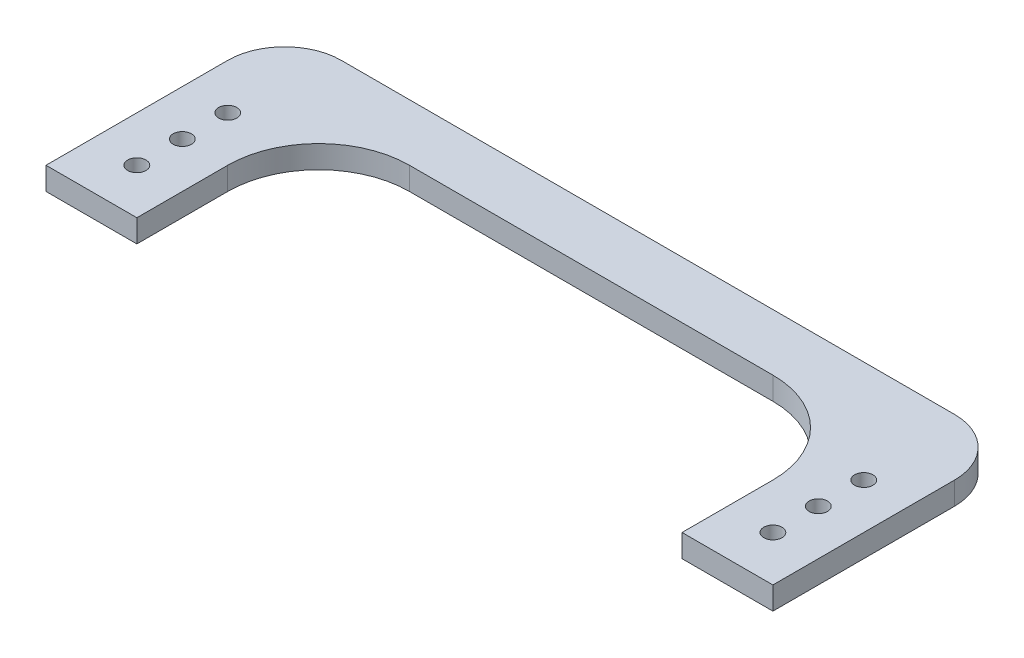
from build123d import *

# Parameters (mm, degrees)
BOSS_EXTRUDE1_DEPTH    = 6.35
F_10_CLEARANCE_HOLE1_D = 5.1054


with BuildPart() as part:
    # Sketch1 → Boss-Extrude1 (new body)
    with BuildSketch(Plane(origin=(0, 0, 0), x_dir=(1, 0, 0), z_dir=(0, 1, 0))):
        with BuildLine():
            Line((-76.2, -25.4), (-76.2, 0))
            ThreePointArc((-76.2, 0), (-68.760512242, 17.960512242), (-50.8, 25.4))
            Line((-50.8, 25.4), (50.8, 25.4))
            ThreePointArc((50.8, 25.4), (68.760512242, 17.960512242), (76.2, 0))
            Line((76.2, 0), (76.2, -25.4))
            Line((76.2, -25.4), (101.6, -25.4))
            Line((101.6, -25.4), (101.6, 25.4))
            ThreePointArc((101.6, 25.4), (96.950320151, 36.625320151), (85.725, 41.275))
            Line((85.725, 41.275), (-85.725, 41.275))
            ThreePointArc((-85.725, 41.275), (-96.950320151, 36.625320151), (-101.6, 25.4))
            Line((-101.6, 25.4), (-101.6, -25.4))
            Line((-101.6, -25.4), (-76.2, -25.4))
        make_face()
    extrude(amount=BOSS_EXTRUDE1_DEPTH)

    # #10 Clearance Hole1 (through all)
    with Locations(Plane(origin=(0, 6.35, 0), x_dir=(1, 0, 0), z_dir=(0, 1, 0))):
        with Locations((-88.9, -12.7), (-88.9, 0), (-88.9, 12.7), (88.9, 12.7), (88.9, 0), (88.9, -12.7)):
            Hole(F_10_CLEARANCE_HOLE1_D / 2)


solid = part.part
